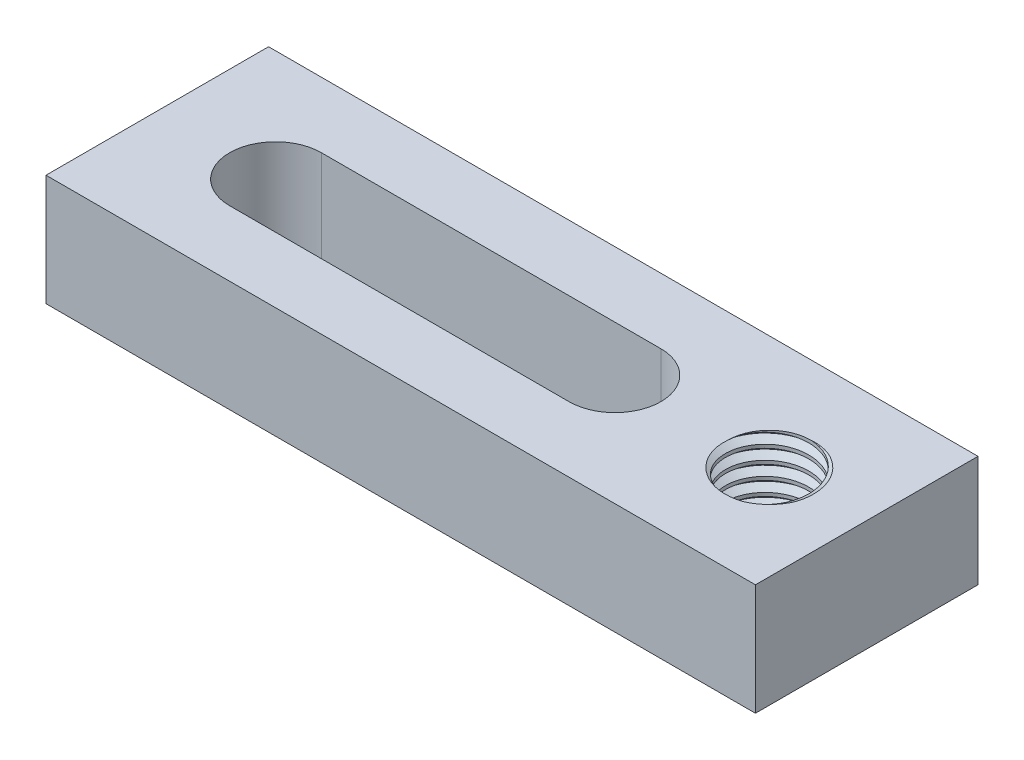
from build123d import *

# Parameters (mm, degrees)
CROQUIS3_W              = 51
CROQUIS3_H              = 16
SALIENTE_EXTRUIR1_DEPTH = 8
CORTAR_EXTRUIR4_DEPTH   = 55.046276467
CROQUIS32_R             = 3
CORTAR_EXTRUIR6_DEPTH   = 55.046276467
ROSCA4_PITCH            = 1


with BuildPart() as part:
    # Croquis3 → Saliente-Extruir1 (new body)
    with BuildSketch(Plane(origin=(0, 0, 0), x_dir=(1, 0, 0), z_dir=(0, 1, 0))):
        with Locations((25.5, 8)):
            Rectangle(CROQUIS3_W, CROQUIS3_H)
    extrude(amount=SALIENTE_EXTRUIR1_DEPTH)

    # Croquis15 → Cortar-Extruir4 (cut, through all)
    with BuildSketch(Plane(origin=(0, 8, 0), x_dir=(1, 0, 0), z_dir=(0, 1, 0))):
        with BuildLine():
            Line((8.5, 11.3), (32.9, 11.3))
            ThreePointArc((32.9, 11.3), (36.2, 8), (32.9, 4.7))
            Line((32.9, 4.7), (8.5, 4.7))
            ThreePointArc((8.5, 4.7), (5.2, 8), (8.5, 11.3))
        make_face()
    extrude(amount=-CORTAR_EXTRUIR4_DEPTH, mode=Mode.SUBTRACT)

    # Croquis32 → Cortar-Extruir6 (cut, through all)
    with BuildSketch(Plane(origin=(0, 8, 0), x_dir=(1, 0, 0), z_dir=(0, 1, 0))):
        with Locations(Location((44, 8, 0), (0, 0, 270))):
            Circle(CROQUIS32_R)
    extrude(amount=-CORTAR_EXTRUIR6_DEPTH, mode=Mode.SUBTRACT)

    # Rosca4: the profile of Perfil de rosca6 profile screwed along a right-hand helix of 13 turns, 8 arcs to a turn; built about Z, then put on its axis
    rosca4_z = Axis((0, 0, 0), (0, 0, 1))
    rosca4_corners = [(2.9997, 0, -0.000173205), (3.541265875, 0, 0.312499999), (3.541265875, 0, 0.437499999), (2.9997, 0, 0.750173202)]
    with BuildLine(mode=Mode.PRIVATE) as rosca4_profile:
        Line(rosca4_corners[0], rosca4_corners[1])
        Line(rosca4_corners[1], rosca4_corners[2])
        Line(rosca4_corners[2], rosca4_corners[3])
        Line(rosca4_corners[3], rosca4_corners[0])
    rosca4_cap = Face(rosca4_profile.wire())
    rosca4_turn_angles = [0, 22.5, 45, 67.5, 90, 112.5, 135, 157.5, 180, 202.5, 225, 247.5, 270, 292.5, 315, 337.5, 360]
    rosca4_turn_weights = [1, 0.9238795325112867, 1, 0.9238795325112867, 1, 0.9238795325112867, 1, 0.9238795325112867, 1, 0.9238795325112867, 1, 0.9238795325112867, 1, 0.9238795325112867, 1, 0.9238795325112867, 1]
    rosca4_turn_rails = [Edge.make_bspline([Vector(p[0], p[1], 0).rotate(rosca4_z, rosca4_turn_angles[k]) / rosca4_turn_weights[k] + Vector(0, 0, p[2] + ROSCA4_PITCH * rosca4_turn_angles[k] / 360) for k in range(17)], [0, 0, 0, 1, 1, 2, 2, 3, 3, 4, 4, 5, 5, 6, 6, 7, 7, 8, 8, 8], 2, rosca4_turn_weights) for p in rosca4_corners]
    rosca4_turn_sides = [Face.make_surface_from_curves(rosca4_turn_rails[p[0]], rosca4_turn_rails[p[1]]) for p in [(0, 1), (1, 2), (2, 3), (3, 0)]]
    rosca4 = Plane(origin=(44, 13, -8), x_dir=(-1, 0, 0), z_dir=(0, -1, 0)) * Solid(Shell([*[p.moved(Location((0, 0, ROSCA4_PITCH * i))) for i in range(13) for p in rosca4_turn_sides], rosca4_cap, rosca4_cap.rotate(rosca4_z, 4680).moved(Location((0, 0, ROSCA4_PITCH * 4680 / 360)))]))
    add(rosca4, mode=Mode.SUBTRACT)


solid = part.part
